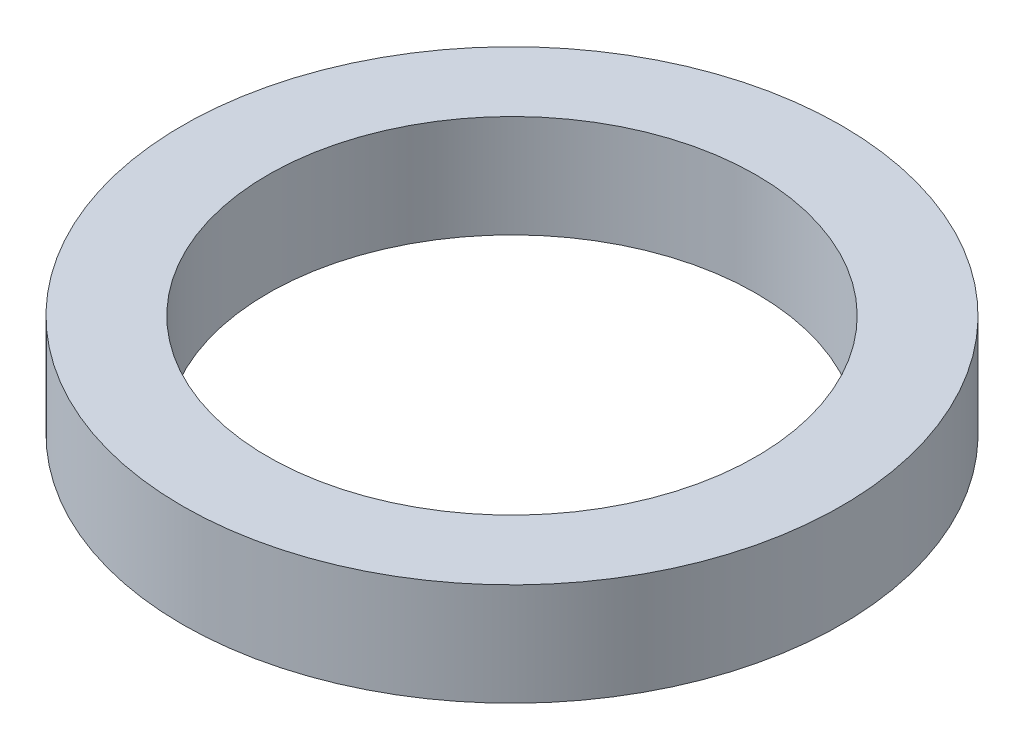
from build123d import *

# Parameters (mm, degrees)
SKETCH1_R           = 67.5
BOSS_EXTRUDE1_DEPTH = 21
SKETCH2_R           = 50
CUT_EXTRUDE1_DEPTH  = 98.742007346


with BuildPart() as part:
    # Sketch1 → Boss-Extrude1 (new body)
    with BuildSketch(Plane(origin=(0, 0, 0), x_dir=(1, 0, 0), z_dir=(0, 1, 0))):
        Circle(SKETCH1_R)
    extrude(amount=BOSS_EXTRUDE1_DEPTH)

    # Sketch2 → Cut-Extrude1 (cut, through all)
    with BuildSketch(Plane(origin=(0, 0, 0), x_dir=(1, 0, 0), z_dir=(0, 1, 0))):
        Circle(SKETCH2_R)
    extrude(amount=CUT_EXTRUDE1_DEPTH, mode=Mode.SUBTRACT)


solid = part.part
